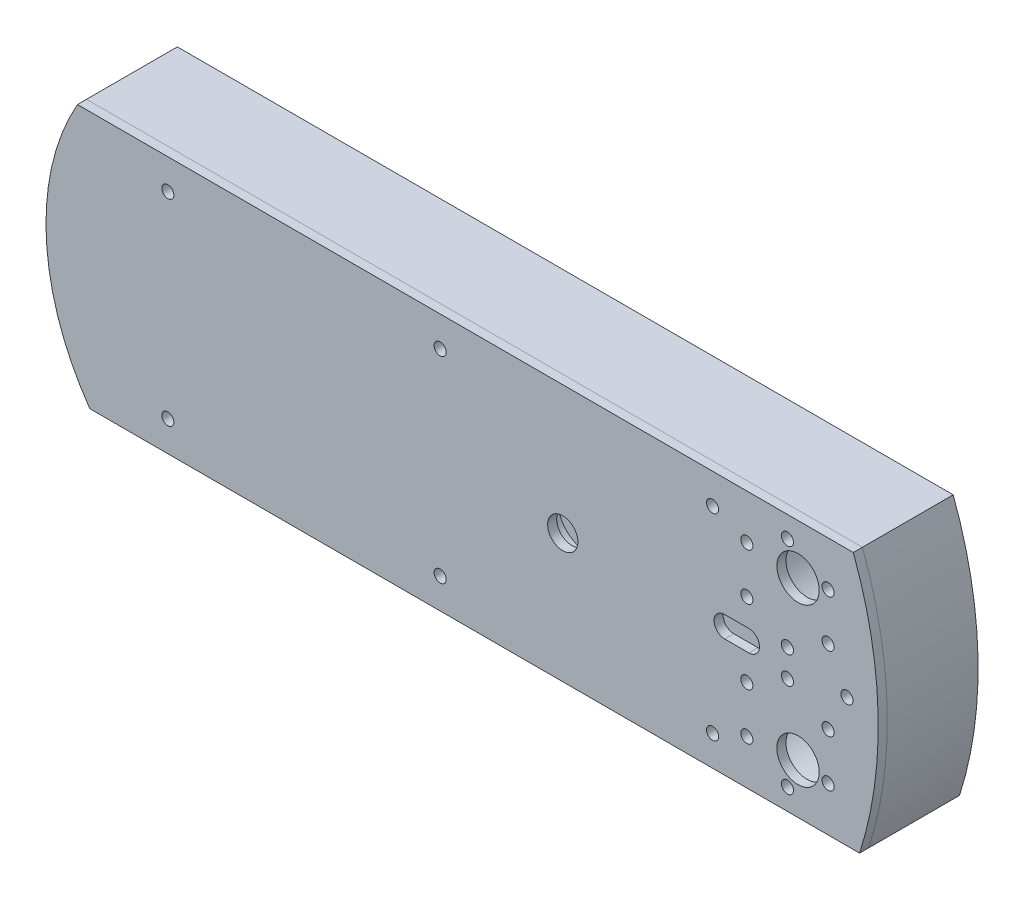
from build123d import *

# Parameters (mm, degrees)
BOSS_EXTRUDE1_OUTLINE_R   = 2.5
BOSS_EXTRUDE1_OUTLINE_R_2 = 18.5
BOSS_EXTRUDE1_OUTLINE_R_3 = 9.5
BOSS_EXTRUDE1_DEPTH       = 30
SKETCH3_R                 = 2
SKETCH3_R_2               = 2.5
SKETCH3_R_3               = 18.5
SKETCH3_R_4               = 9.5
SKETCH3_R_5               = 7
SKETCH3_R_6               = 5
BOSS_EXTRUDE2_DEPTH       = 3
BOSS_EXTRUDE3_START       = -5
SKETCH6_R                 = 9.5
SKETCH6_R_2               = 5.5
BOSS_EXTRUDE3_DEPTH       = 20


# Read off the part's stored shape, not the designer's step: Boss-Extrude1
with BuildPart() as part:
    # Boss-Extrude1 outline → Boss-Extrude1 (new body)
    with BuildSketch(Plane.XY):
        with BuildLine():
            ThreePointArc((-99.604231658, 42.5), (-109.908381706, -0.593648146), (-95.517561959, -42.5))
            Line((-95.517561959, -42.5), (158.843575198, -42.5))
            ThreePointArc((158.843575198, -42.5), (164.961358829, 0.174595682), (156.769378449, 42.5))
            Line((156.769378449, 42.5), (-99.604231658, 42.5))
        make_face()
        with Locations((-55.8, -21.5)):
            Circle(BOSS_EXTRUDE1_OUTLINE_R, mode=Mode.SUBTRACT)
        with Locations((135, -20)):
            Circle(BOSS_EXTRUDE1_OUTLINE_R_2, mode=Mode.SUBTRACT)
        with Locations((60.751926796, 0)):
            Circle(BOSS_EXTRUDE1_OUTLINE_R_3, mode=Mode.SUBTRACT)
        with Locations((135, 20)):
            Circle(BOSS_EXTRUDE1_OUTLINE_R_2, mode=Mode.SUBTRACT)
    extrude(amount=BOSS_EXTRUDE1_DEPTH)

    # Sketch6 → Boss-Extrude3 (add)
    with BuildSketch(Plane(origin=(0, 0, 0), x_dir=(-1, 0, 0), z_dir=(0, 0, -1)).offset(BOSS_EXTRUDE3_START)):
        with Locations((-60.751926796, 0)):
            Circle(SKETCH6_R)
        with Locations((-60.751926796, 0)):
            Circle(SKETCH6_R_2, mode=Mode.SUBTRACT)
    extrude(amount=-BOSS_EXTRUDE3_DEPTH)


with BuildPart() as body_2:
    # Sketch3 → Boss-Extrude2 (new body)
    # profile 1 of 7: a face of its own
    with BuildSketch(Plane.XY.offset(30)):
        with BuildLine():
            ThreePointArc((-99.604231658, 42.5), (-109.908381706, -0.593648146), (-95.517561959, -42.5))
            Line((-95.517561959, -42.5), (-88.525744823, -42.5))
            ThreePointArc((-88.525744823, -42.5), (-94.643528454, 0.174595682), (-86.451548074, 42.5))
            Line((-86.451548074, 42.5), (-99.604231658, 42.5))
        make_face()
    # profile 2 of 7: a face of its own
    with BuildSketch(Plane.XY.offset(30)):
        with BuildLine():
            ThreePointArc((-86.451548074, 42.5), (-94.643528454, 0.174595682), (-88.525744823, -42.5))
            Line((-88.525744823, -42.5), (34.333135379, -42.5))
            ThreePointArc((34.333135379, -42.5), (45.108430133, -20.759597294), (48.81557342, 3.219751644))
            ThreePointArc((48.81557342, 3.219751644), (46.172649196, 23.536062273), (38.419805078, 42.5))
            Line((38.419805078, 42.5), (-86.451548074, 42.5))
        make_face()
        with Locations((-69.748073204, -32.5)):
            Circle(SKETCH3_R, mode=Mode.SUBTRACT)
        with Locations((-55.8, -21.5)):
            Circle(SKETCH3_R_2, mode=Mode.SUBTRACT)
        with Locations((20.251926796, -32.5)):
            Circle(SKETCH3_R, mode=Mode.SUBTRACT)
        with Locations((-69.748073204, 32.5)):
            Circle(SKETCH3_R, mode=Mode.SUBTRACT)
        with Locations((20.251926796, 32.5)):
            Circle(SKETCH3_R, mode=Mode.SUBTRACT)
    # profile 3 of 7: a face of its own
    with BuildSketch(Plane.XY.offset(30)):
        with BuildLine():
            ThreePointArc((48.81557342, 3.219751644), (45.108430133, -20.759597294), (34.333135379, -42.5))
            Line((34.333135379, -42.5), (158.843575198, -42.5))
            ThreePointArc((158.843575198, -42.5), (163.451661934, -22.984843715), (165, -2.992884395))
            ThreePointArc((165, -2.992884395), (162.925776657, 20.122833535), (156.769378449, 42.5))
            Line((156.769378449, 42.5), (38.419805078, 42.5))
            ThreePointArc((38.419805078, 42.5), (46.172649196, 23.536062273), (48.81557342, 3.219751644))
        make_face()
        with Locations((110.251926796, -32.5)):
            Circle(SKETCH3_R, mode=Mode.SUBTRACT)
        with Locations((135, -20)):
            Circle(SKETCH3_R_3, mode=Mode.SUBTRACT)
        with Locations((60.751926796, 0)):
            Circle(SKETCH3_R_4, mode=Mode.SUBTRACT)
        with BuildLine():
            ThreePointArc((114.251926796, -3.5), (110.751926796, 0), (114.251926796, 3.5))
            Line((114.251926796, 3.5), (122.251926796, 3.5))
            ThreePointArc((122.251926796, 3.5), (125.751926796, 0), (122.251926796, -3.5))
            Line((122.251926796, -3.5), (114.251926796, -3.5))
        make_face(mode=Mode.SUBTRACT)
        with Locations((154.66268289, 0)):
            Circle(SKETCH3_R, mode=Mode.SUBTRACT)
        with Locations((135, 20)):
            Circle(SKETCH3_R_3, mode=Mode.SUBTRACT)
        with Locations((110.251926796, 32.5)):
            Circle(SKETCH3_R, mode=Mode.SUBTRACT)
    # profile 4 of 7: a face of its own
    with BuildSketch(Plane.XY.offset(30)):
        with Locations((135, 20)):
            Circle(SKETCH3_R_3)
        with Locations((138.5, 26.062177826)):
            Circle(SKETCH3_R_5, mode=Mode.SUBTRACT)
        with Locations((135, 35.5)):
            Circle(SKETCH3_R, mode=Mode.SUBTRACT)
        with Locations((121.576606241, 27.75)):
            Circle(SKETCH3_R, mode=Mode.SUBTRACT)
        with Locations((135, 4.5)):
            Circle(SKETCH3_R, mode=Mode.SUBTRACT)
        with Locations((121.576606241, 12.25)):
            Circle(SKETCH3_R, mode=Mode.SUBTRACT)
        with Locations((148.423393759, 12.25)):
            Circle(SKETCH3_R, mode=Mode.SUBTRACT)
        with Locations((148.423393759, 27.75)):
            Circle(SKETCH3_R, mode=Mode.SUBTRACT)
    # profile 5 of 7: a face of its own
    with BuildSketch(Plane.XY.offset(30)):
        with Locations((135, -20)):
            Circle(SKETCH3_R_3)
        with Locations((135, -35.5)):
            Circle(SKETCH3_R, mode=Mode.SUBTRACT)
        with Locations((148.423393759, -27.75)):
            Circle(SKETCH3_R, mode=Mode.SUBTRACT)
        with Locations((148.423393759, -12.25)):
            Circle(SKETCH3_R, mode=Mode.SUBTRACT)
        with Locations((135, -4.5)):
            Circle(SKETCH3_R, mode=Mode.SUBTRACT)
        with Locations((121.576606241, -12.25)):
            Circle(SKETCH3_R, mode=Mode.SUBTRACT)
        with Locations((121.576606241, -27.75)):
            Circle(SKETCH3_R, mode=Mode.SUBTRACT)
        with Locations((138.5, -26.062177826)):
            Circle(SKETCH3_R_5, mode=Mode.SUBTRACT)
    # profile 6 of 7: a face of its own
    with BuildSketch(Plane.XY.offset(30)):
        with Locations((60.751926796, 0)):
            Circle(SKETCH3_R_4)
        with Locations((60.751926796, 0)):
            Circle(SKETCH3_R_6, mode=Mode.SUBTRACT)
    # profile 7 of 7: a face of its own
    with BuildSketch(Plane.XY.offset(30)):
        with Locations((-55.8, -21.5)):
            Circle(SKETCH3_R_2)
    extrude(amount=BOSS_EXTRUDE2_DEPTH)


solid = Compound([part.part, body_2.part])
